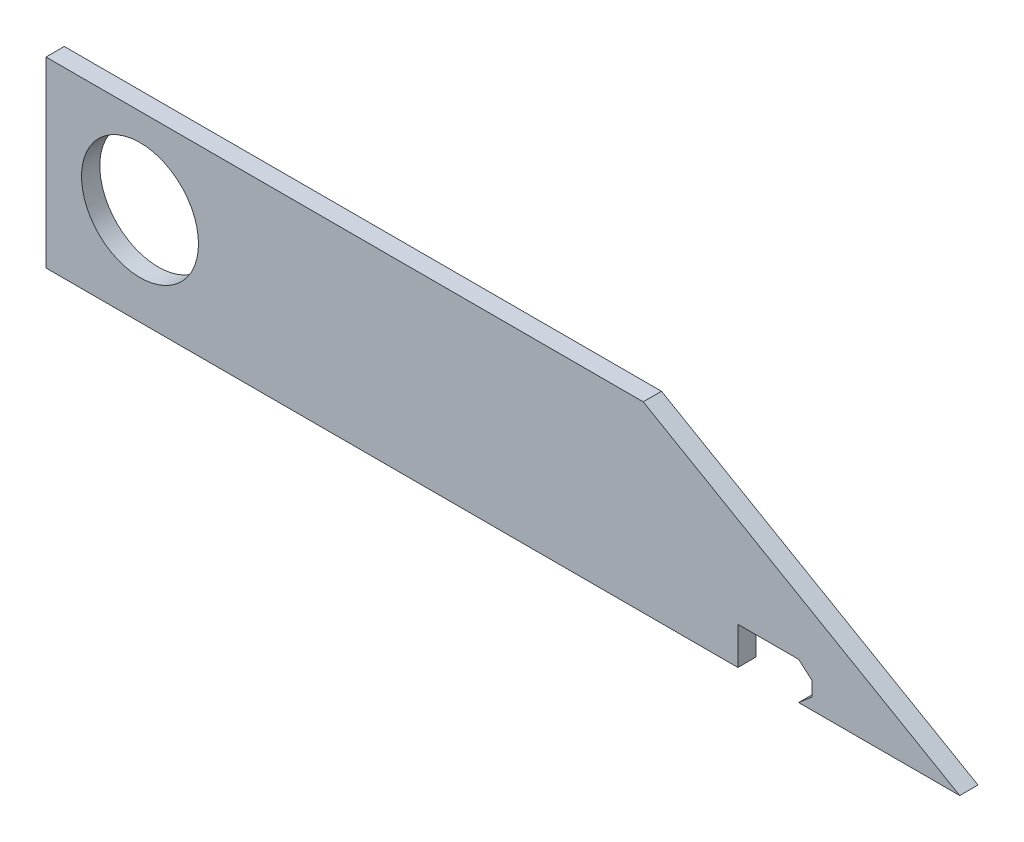
from build123d import *

# Parameters (mm, degrees)
BOSS_EXTRUDE1_DEPTH = 2.54
SKETCH3_R           = 8.128
CUT_EXTRUDE1_DEPTH  = 2.54
CUT_EXTRUDE2_DEPTH  = 70.365276616


with BuildPart() as part:
    # Sketch2 → Boss-Extrude1 (new body)
    with BuildSketch(Plane.XY):
        Polygon((-63.5, 2.4), (63.5, 2.4), (19.505909488, 27.8), (-63.5, 27.8), align=None)
    extrude(amount=-BOSS_EXTRUDE1_DEPTH)

    # Sketch3 → Cut-Extrude1 (cut)
    with BuildSketch(Plane.XY):
        with Locations((-50.434775134, 15.906072529)):
            Circle(SKETCH3_R)
    extrude(amount=-CUT_EXTRUDE1_DEPTH, mode=Mode.SUBTRACT)

    # Sketch4 → Cut-Extrude2 (cut, through all)
    with BuildSketch(Plane(origin=(0, 0, -2.54), x_dir=(-1, 0, 0), z_dir=(0, 0, -1))):
        Polygon((-41.105403431, 7.6), (-32.667342272, 7.6), (-32.667342272, 2.4), (-41.105403431, 2.4), (-42.967342272, 4), (-42.967342272, 6), align=None)
    extrude(amount=-CUT_EXTRUDE2_DEPTH, mode=Mode.SUBTRACT)


solid = part.part
